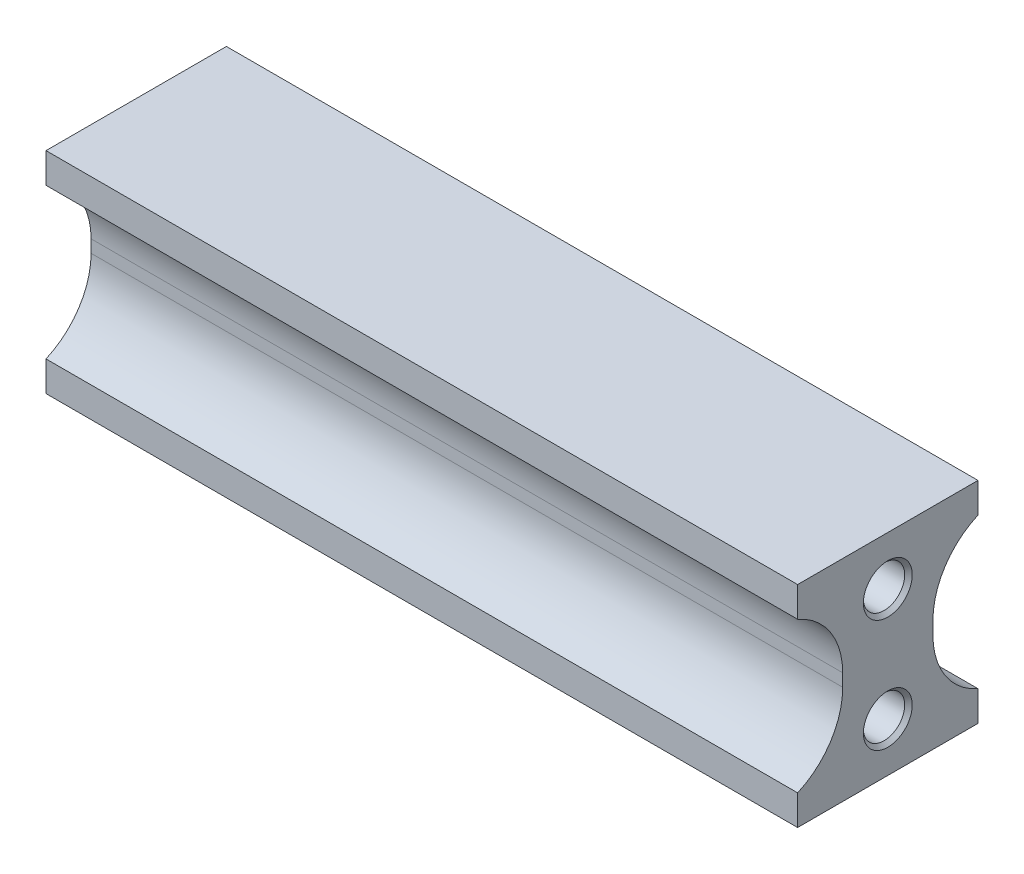
from build123d import *

# Parameters (mm, degrees)
SKETCH_1_R      = 2.75
EXTRUDE_1_DEPTH = 100
FILLET_1_R      = 10
CHAMFER_1_SIZE  = 0.5


with BuildPart() as part:
    # 草图1 → 凸台-拉伸1 (new body)
    with BuildSketch(Plane(origin=(0, 0, 0), x_dir=(0, 0, -1), z_dir=(1, 0, 0))):
        Polygon((-12, 0), (12, 0), (12, 4), (6, 4), (6, 24), (12, 24), (12, 28), (-12, 28), (-12, 24), (-6, 24), (-6, 4), (-12, 4), align=None)
        with Locations((0, 21.5)):
            Circle(SKETCH_1_R, mode=Mode.SUBTRACT)
        with Locations((0, 6.5)):
            Circle(SKETCH_1_R, mode=Mode.SUBTRACT)
    extrude(amount=EXTRUDE_1_DEPTH)

    # 圆角1
    # the kernel refuses this fillet: 10 mm, written as the material it adds along each edge
    with BuildSketch(Plane(origin=(0, 24, -6), x_dir=(0, -1, 0), z_dir=(1, 0, 0)), Plane(origin=(0, 4, 6), x_dir=(0, 1, 0), z_dir=(1, 0, 0))) as fillet_1_piece_1:
        with BuildLine():
            CenterArc((9.16515139, 10), FILLET_1_R, 203.578178478, 66.421821522)
            Line((0, 6), (-0.183303028, 5.92))
            ThreePointArc((-0.183303028, 5.92), (-0.2, 3), (-0.2, 0))
            Line((-0.2, 0), (0, -0.2))
            Line((0, -0.2), (9.16515139, -0.2))
            Line((9.16515139, -0.2), (9.16515139, 0))
        make_face()
    extrude(amount=100)
    with BuildSketch(Plane(origin=(0, 4, -6), x_dir=(0, 0, -1), z_dir=(1, 0, 0)), Plane(origin=(0, 24, 6), x_dir=(0, 0, 1), z_dir=(1, 0, 0))) as fillet_1_piece_2:
        with BuildLine():
            CenterArc((10, 9.16515139), FILLET_1_R, 180, 66.421821522)
            Line((0, 9.16515139), (-0.2, 9.16515139))
            Line((-0.2, 9.16515139), (-0.2, 0))
            Line((-0.2, 0), (0, -0.2))
            ThreePointArc((0, -0.2), (3, -0.2), (5.92, -0.183303028))
            Line((5.92, -0.183303028), (6, 0))
        make_face()
    extrude(amount=100)

    # 倒角1
    chamfer_1_edges = [part.edges().sort_by_distance(p)[0] for p in [
        (0, 21.5, 2.75),
        (100, 21.5, 2.75),
        (0, 6.5, 2.75),
        (100, 6.5, 2.75),
    ]]
    chamfer(chamfer_1_edges, length=CHAMFER_1_SIZE)


solid = part.part
